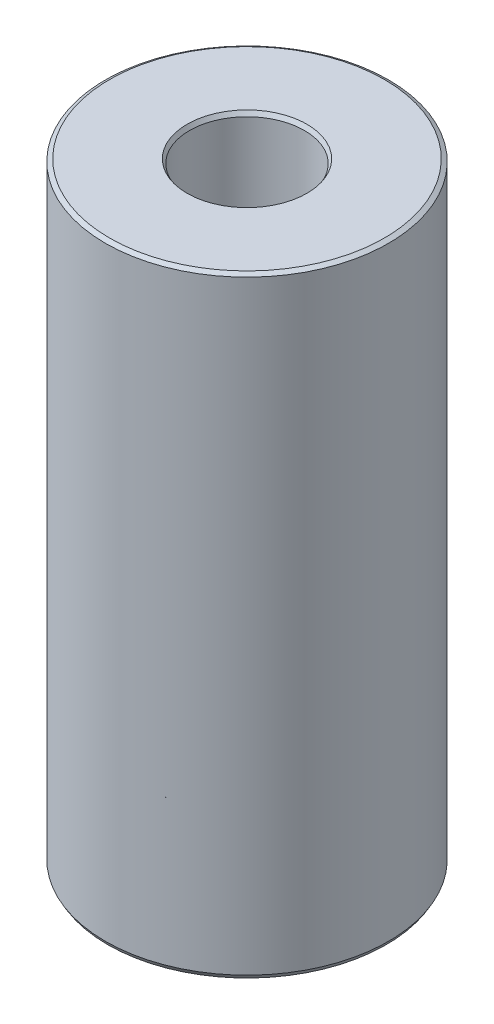
from build123d import *
from OCP.BRepFilletAPI import BRepFilletAPI_MakeChamfer

# Parameters (mm, degrees)
SKETCH1_R           = 50
BOSS_EXTRUDE1_DEPTH = 215.817890661
SKETCH2_R           = 20.294608374
CUT_EXTRUDE1_DEPTH  = 228.106499091
CHAMFER1_SIZE       = 0.857235089
CHAMFER1_SIZE2      = 1.484774727


with BuildPart() as part:
    # Sketch1 → Boss-Extrude1 (new body)
    with BuildSketch(Plane(origin=(0, 0, 0), x_dir=(1, 0, 0), z_dir=(0, 1, 0))):
        Circle(SKETCH1_R)
    extrude(amount=BOSS_EXTRUDE1_DEPTH)

    # Sketch2 → Cut-Extrude1 (cut, through all)
    with BuildSketch(Plane(origin=(0, 0, 0), x_dir=(1, 0, 0), z_dir=(0, 1, 0))):
        Circle(SKETCH2_R)
    extrude(amount=CUT_EXTRUDE1_DEPTH, mode=Mode.SUBTRACT)

    # Chamfer1: one chamfer whose edges measure the first distance from different faces: ONE call of the kernel's chamfer builder (chamfer() names one face for all edges)
    chamfer1_edges_1 = [part.edges().sort_by_distance(p)[0] for p in [
        (-20.294608374, 215.817890661, 0),
    ]]
    chamfer1_side_1 = [part.faces().sort_by_distance(p)[0] for p in [
        (-48.585786438, 215.817890661, 0),
    ]]
    chamfer1_edges_2 = [part.edges().sort_by_distance(p)[0] for p in [
        (-20.294608374, 0, 0),
    ]]
    chamfer1_side_2 = [part.faces().sort_by_distance(p)[0] for p in [
        (-20.294608374, 107.90894533, 0),
    ]]
    chamfer1_edges_3 = [part.edges().sort_by_distance(p)[0] for p in [
        (-50, 0, 0),
    ]]
    chamfer1_side_3 = [part.faces().sort_by_distance(p)[0] for p in [
        (-48.585786438, 0, 0),
    ]]
    chamfer1_edges_4 = [part.edges().sort_by_distance(p)[0] for p in [
        (-50, 215.817890661, 0),
    ]]
    chamfer1_side_4 = [part.faces().sort_by_distance(p)[0] for p in [
        (-50, 107.90894533, 0),
    ]]
    chamfer1 = BRepFilletAPI_MakeChamfer(part.part.solid().wrapped)
    for e in chamfer1_edges_1:
        chamfer1.Add(CHAMFER1_SIZE, CHAMFER1_SIZE2, e.wrapped, chamfer1_side_1[0].wrapped)  # the first distance lies on this face
    for e in chamfer1_edges_2:
        chamfer1.Add(CHAMFER1_SIZE, CHAMFER1_SIZE2, e.wrapped, chamfer1_side_2[0].wrapped)  # the first distance lies on this face
    for e in chamfer1_edges_3:
        chamfer1.Add(CHAMFER1_SIZE, CHAMFER1_SIZE2, e.wrapped, chamfer1_side_3[0].wrapped)  # the first distance lies on this face
    for e in chamfer1_edges_4:
        chamfer1.Add(CHAMFER1_SIZE, CHAMFER1_SIZE2, e.wrapped, chamfer1_side_4[0].wrapped)  # the first distance lies on this face
    add(Compound.cast(chamfer1.Shape()), mode=Mode.REPLACE)


solid = part.part
